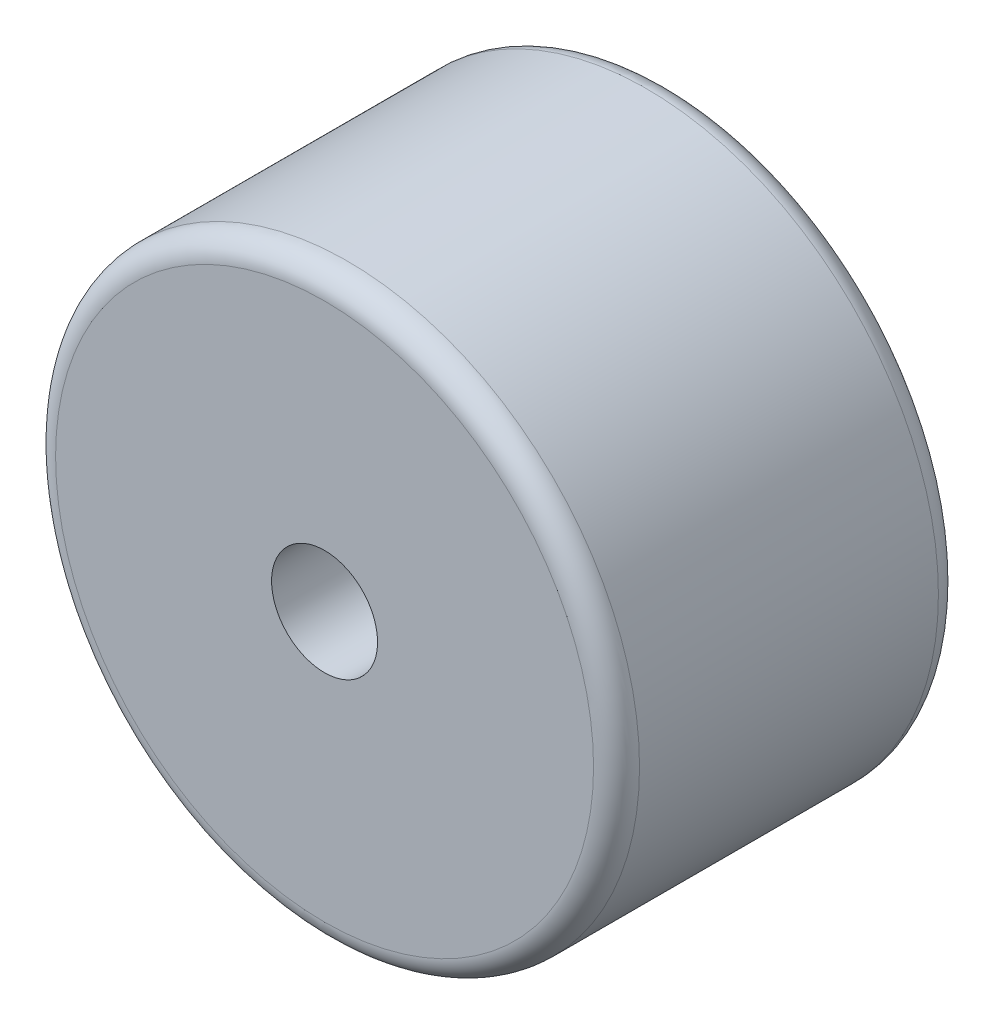
from build123d import *

# Parameters (mm, degrees)
BODY_SKETCH_R    = 12.7
WHEEL_BODY_DEPTH = 7.5
FILLET_WHEEL_R   = 1
HOLE_SKETCH_R    = 2.305
HOLE_SHAFT_DEPTH = 15


with BuildPart() as part:
    # body sketch → wheel body (new, symmetric)
    with BuildSketch(Plane.XY):
        Circle(BODY_SKETCH_R)
    extrude(amount=WHEEL_BODY_DEPTH, both=True)

    # fillet wheel
    fillet_wheel_edges = [part.edges().sort_by_distance(p)[0] for p in [
        (-12.7, 0, -7.5),
        (-12.7, 0, 7.5),
    ]]
    fillet(fillet_wheel_edges, radius=FILLET_WHEEL_R)

    # hole sketch → hole shaft (cut)
    with BuildSketch(Plane.XY.offset(7.5)):
        Circle(HOLE_SKETCH_R)
    extrude(amount=-HOLE_SHAFT_DEPTH, mode=Mode.SUBTRACT)


solid = part.part
